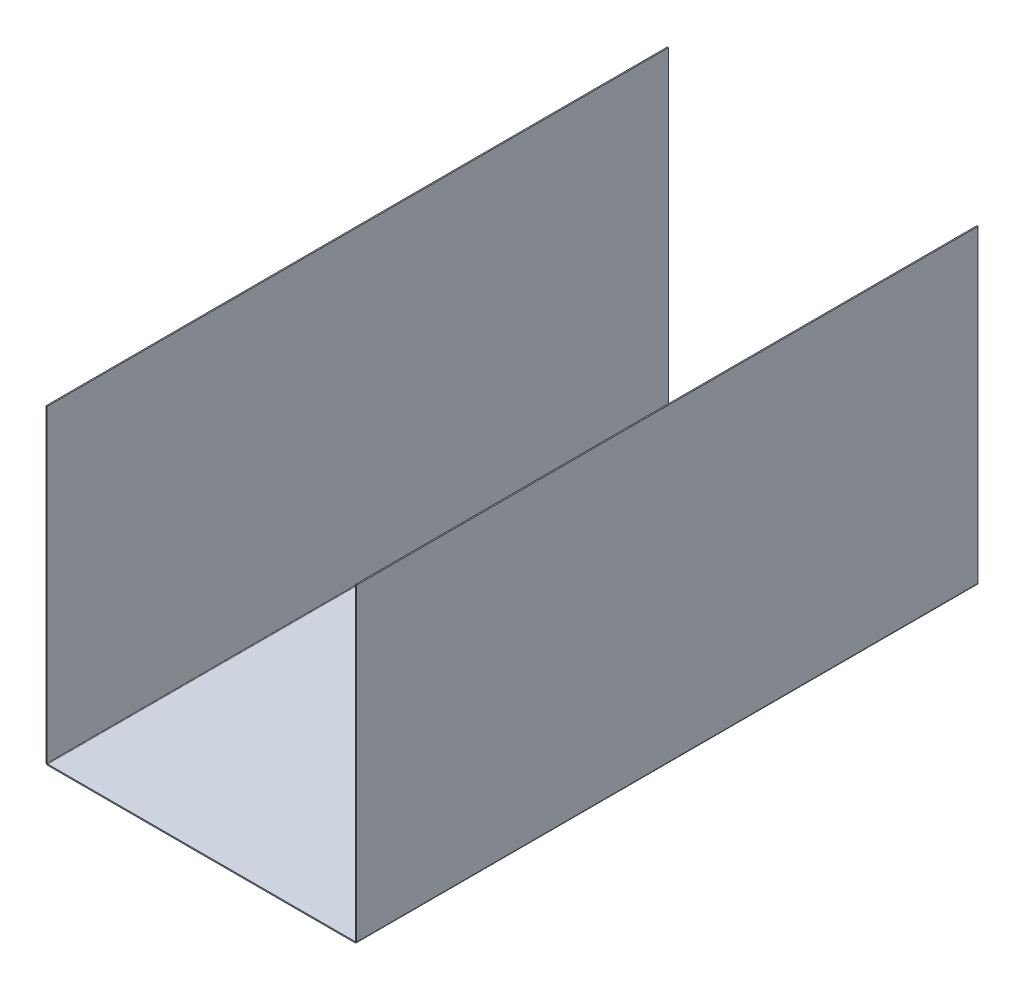
from build123d import *

# Parameters (mm, degrees)
TABAN_FLAN_1_DEPTH = 400


# Sheet-metal steps are written as plain solids
with BuildPart() as part:
    # Çizim1 → Taban-Flanş1 (new, symmetric)
    with BuildSketch(Plane.XY):
        with BuildLine():
            Line((-200, 400), (-200, 2.2366))
            ThreePointArc((-200, 2.2366), (-199.344915027, 0.655084973), (-197.7634, 0))
            Line((-197.7634, 0), (197.7634, 0))
            ThreePointArc((197.7634, 0), (199.344915027, 0.655084973), (200, 2.2366))
            Line((200, 2.2366), (200, 400))
            Line((200, 400), (198.5, 400))
            Line((198.5, 400), (198.5, 2.2366))
            ThreePointArc((198.5, 2.2366), (198.284254855, 1.715745145), (197.7634, 1.5))
            Line((197.7634, 1.5), (-197.7634, 1.5))
            ThreePointArc((-197.7634, 1.5), (-198.284254855, 1.715745145), (-198.5, 2.2366))
            Line((-198.5, 2.2366), (-198.5, 400))
            Line((-198.5, 400), (-200, 400))
        make_face()
    extrude(amount=TABAN_FLAN_1_DEPTH, both=True)


solid = part.part
